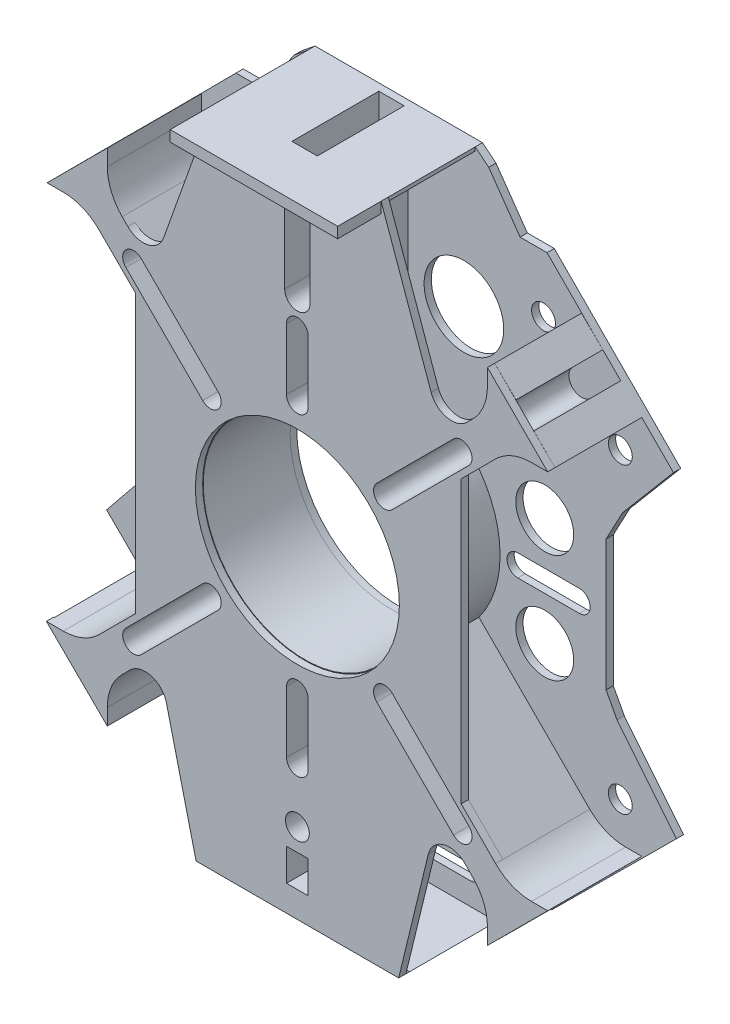
from build123d import *

# Parameters (mm, degrees)
BOSS_EXTRUDE1_OUTLINE_R         = 1.65
BOSS_EXTRUDE1_OUTLINE_R_2       = 9
BOSS_EXTRUDE1_DEPTH             = 1
SKETCH2_R                       = 14
SKETCH2_R_2                     = 1.65
SKETCH2_W                       = 3
SKETCH2_H                       = 4.43079702
BOSS_EXTRUDE2_DEPTH             = 12
BOSS_EXTRUDE2_DIRECTION_2_REACH = 63.396
SKETCH4_R                       = 14.089378666
SKETCH4_R_2                     = 1.65
SKETCH4_W                       = 3
SKETCH4_H                       = 4.43079702
BOSS_EXTRUDE3_DEPTH             = 1
SKETCH5_W                       = 23.128323924
SKETCH5_H                       = 1.5
BOSS_EXTRUDE4_DEPTH             = 6
CUT_EXTRUDE1_START              = -10
SKETCH6_R                       = 14.089378666
SKETCH6_R_2                     = 4
SKETCH6_R_3                     = 5.5
CUT_EXTRUDE1_DEPTH              = 10


# Read off the part's stored shape, not the designer's step: Boss-Extrude1
with BuildPart() as part:
    # Boss-Extrude1 outline → Boss-Extrude1 (new body)
    with BuildSketch(Plane.XY):
        Polygon((-13.989604918, -44.585312397), (13.989604918, -44.585312397), (15.364158174, -43.219581062), (15.364158174, -38.878084859), (22.144989251, -38.850540354), (39.351031245, -21.754927214), (31.155749084, -11.64882797), (29.63770528, -8.800437365), (29.63770528, 9.258229776), (31.914413679, 13.530145247), (38.947274579, 21.845237215), (21.483203913, 39.422116781), (17.759375685, 39.422116781), (13.431703833, 45.602672711), (11.564161962, 47.117107925), (-11.564161962, 47.117107925), (-13.431703833, 45.602672711), (-17.759375685, 39.422116781), (-21.483203913, 39.422116781), (-38.947274579, 21.845237215), (-31.914413679, 13.530145247), (-29.63770528, 9.258229776), (-29.63770528, -8.800437365), (-31.155749084, -11.64882797), (-39.351031245, -21.754927214), (-22.144989251, -38.850540354), (-15.364158174, -38.878084859), (-15.364158174, -43.219581062), align=None)
        with Locations((-21, -31.5)):
            Circle(BOSS_EXTRUDE1_OUTLINE_R, mode=Mode.SUBTRACT)
        with Locations((-31.606601718, -20.893398282)):
            Circle(BOSS_EXTRUDE1_OUTLINE_R, mode=Mode.SUBTRACT)
        with BuildLine():
            Line((-17.445654013, -1.5), (-25.945654013, -1.5))
            ThreePointArc((-25.945654013, -1.5), (-27.445654013, 0), (-25.945654013, 1.5))
            Line((-25.945654013, 1.5), (-17.445654013, 1.5))
            ThreePointArc((-17.445654013, 1.5), (-15.945654013, 0), (-17.445654013, -1.5))
        make_face(mode=Mode.SUBTRACT)
        with BuildLine():
            Line((-23.687647821, -21.566327477), (-13.081904801, -10.960584458))
            ThreePointArc((-13.081904801, -10.960584458), (-10.960584458, -10.960584458), (-10.960584458, -13.081904801))
            Line((-10.960584458, -13.081904801), (-21.566327477, -23.687647821))
            ThreePointArc((-21.566327477, -23.687647821), (-23.687647821, -23.687647821), (-23.687647821, -21.566327477))
        make_face(mode=Mode.SUBTRACT)
        with BuildLine():
            Line((11, -41), (-11, -41))
            ThreePointArc((-11, -41), (-12, -40), (-11, -39))
            Line((-11, -39), (11, -39))
            ThreePointArc((11, -39), (12, -40), (11, -41))
        make_face(mode=Mode.SUBTRACT)
        with Locations((0, -33.5)):
            Circle(BOSS_EXTRUDE1_OUTLINE_R, mode=Mode.SUBTRACT)
        with BuildLine():
            Line((1.5, -17.445654013), (1.5, -25.945654013))
            ThreePointArc((1.5, -25.945654013), (0, -27.445654013), (-1.5, -25.945654013))
            Line((-1.5, -25.945654013), (-1.5, -17.445654013))
            ThreePointArc((-1.5, -17.445654013), (0, -15.945654013), (1.5, -17.445654013))
        make_face(mode=Mode.SUBTRACT)
        with Locations((21, -31.5)):
            Circle(BOSS_EXTRUDE1_OUTLINE_R, mode=Mode.SUBTRACT)
        with BuildLine():
            Line((21.566327477, -23.687647821), (10.960584458, -13.081904801))
            ThreePointArc((10.960584458, -13.081904801), (10.960584458, -10.960584458), (13.081904801, -10.960584458))
            Line((13.081904801, -10.960584458), (23.687647821, -21.566327477))
            ThreePointArc((23.687647821, -21.566327477), (23.687647821, -23.687647821), (21.566327477, -23.687647821))
        make_face(mode=Mode.SUBTRACT)
        Circle(BOSS_EXTRUDE1_OUTLINE_R_2, mode=Mode.SUBTRACT)
        with Locations((31.606601718, -20.893398282)):
            Circle(BOSS_EXTRUDE1_OUTLINE_R, mode=Mode.SUBTRACT)
        with BuildLine():
            Line((17.445654013, 1.5), (25.945654013, 1.5))
            ThreePointArc((25.945654013, 1.5), (27.445654013, 0), (25.945654013, -1.5))
            Line((25.945654013, -1.5), (17.445654013, -1.5))
            ThreePointArc((17.445654013, -1.5), (15.945654013, 0), (17.445654013, 1.5))
        make_face(mode=Mode.SUBTRACT)
        with Locations((-31.606601718, 20.893398282)):
            Circle(BOSS_EXTRUDE1_OUTLINE_R, mode=Mode.SUBTRACT)
        with BuildLine():
            Line((-21.566327477, 23.687647821), (-10.960584458, 13.081904801))
            ThreePointArc((-10.960584458, 13.081904801), (-10.960584458, 10.960584458), (-13.081904801, 10.960584458))
            Line((-13.081904801, 10.960584458), (-23.687647821, 21.566327477))
            ThreePointArc((-23.687647821, 21.566327477), (-23.687647821, 23.687647821), (-21.566327477, 23.687647821))
        make_face(mode=Mode.SUBTRACT)
        with Locations((-21, 31.5)):
            Circle(BOSS_EXTRUDE1_OUTLINE_R, mode=Mode.SUBTRACT)
        with BuildLine():
            Line((-1.5, 17.445654013), (-1.5, 25.945654013))
            ThreePointArc((-1.5, 25.945654013), (0, 27.445654013), (1.5, 25.945654013))
            Line((1.5, 25.945654013), (1.5, 17.445654013))
            ThreePointArc((1.5, 17.445654013), (0, 15.945654013), (-1.5, 17.445654013))
        make_face(mode=Mode.SUBTRACT)
        with BuildLine():
            Line((23.687647821, 21.566327477), (13.081904801, 10.960584458))
            ThreePointArc((13.081904801, 10.960584458), (10.960584458, 10.960584458), (10.960584458, 13.081904801))
            Line((10.960584458, 13.081904801), (21.566327477, 23.687647821))
            ThreePointArc((21.566327477, 23.687647821), (23.687647821, 23.687647821), (23.687647821, 21.566327477))
        make_face(mode=Mode.SUBTRACT)
        with Locations((31.606601718, 20.893398282)):
            Circle(BOSS_EXTRUDE1_OUTLINE_R, mode=Mode.SUBTRACT)
        with BuildLine():
            Line((4.5, 41.855351652), (-4.5, 41.855351652))
            ThreePointArc((-4.5, 41.855351652), (-5.366043802, 42.721395454), (-4.5, 43.587439255))
            Line((-4.5, 43.587439255), (4.5, 43.587439255))
            ThreePointArc((4.5, 43.587439255), (5.366043802, 42.721395454), (4.5, 41.855351652))
        make_face(mode=Mode.SUBTRACT)
        with Locations((21, 31.5)):
            Circle(BOSS_EXTRUDE1_OUTLINE_R, mode=Mode.SUBTRACT)
    extrude(amount=BOSS_EXTRUDE1_DEPTH)

    # Sketch2 → Boss-Extrude2 (add)
    with BuildSketch(Plane.XY.offset(1)):
        with BuildLine():
            Line((-24.199747468, 27.381727984), (-8.895608333, 12.077588848))
            ThreePointArc((-8.895608333, 12.077588848), (-5.740251485, 13.858192988), (-2.25, 14.83028995))
            Line((-2.25, 14.83028995), (-2.25, 44.617107925))
            ThreePointArc((-2.25, 44.617107925), (-2.835786438, 46.031321488), (-4.25, 46.617107925))
            Line((-4.25, 46.617107925), (-11.564161962, 46.617107925))
            Line((-11.564161962, 46.617107925), (-11.564161962, 47.117107925))
            Line((-11.564161962, 47.117107925), (-1.75, 47.117107925))
            Line((-1.75, 47.117107925), (-1.75, 29.945654013))
            ThreePointArc((-1.75, 29.945654013), (0, 28.195654013), (1.75, 29.945654013))
            Line((1.75, 29.945654013), (1.75, 47.117107925))
            Line((1.75, 47.117107925), (11.564161962, 47.117107925))
            Line((11.564161962, 47.117107925), (11.564161962, 46.617107925))
            Line((11.564161962, 46.617107925), (4.25, 46.617107925))
            ThreePointArc((4.25, 46.617107925), (2.835786438, 46.031321488), (2.25, 44.617107925))
            Line((2.25, 44.617107925), (2.25, 14.83028995))
            ThreePointArc((2.25, 14.83028995), (5.740251485, 13.858192988), (8.895608333, 12.077588848))
            Line((8.895608333, 12.077588848), (24.199747468, 27.381727984))
            ThreePointArc((24.199747468, 27.381727984), (25.717156728, 29.652691425), (26.25, 32.331475452))
            Line((26.25, 32.331475452), (26.25, 34.570781684))
            Line((26.25, 34.570781684), (29.190331443, 31.665205177))
            Line((29.190331443, 31.665205177), (25.012563133, 27.487436867))
            ThreePointArc((25.012563133, 27.487436867), (25.012563133, 25.012563133), (27.487436867, 25.012563133))
            Line((27.487436867, 25.012563133), (31.657237705, 29.182363971))
            Line((31.657237705, 29.182363971), (34.570781684, 26.25))
            Line((34.570781684, 26.25), (32.331475452, 26.25))
            ThreePointArc((32.331475452, 26.25), (29.652691425, 25.717156728), (27.381727984, 24.199747468))
            Line((27.381727984, 24.199747468), (12.077588848, 8.895608333))
            ThreePointArc((12.077588848, 8.895608333), (15, 0), (12.077588848, -8.895608333))
            Line((12.077588848, -8.895608333), (27.381727984, -24.199747468))
            ThreePointArc((27.381727984, -24.199747468), (29.652691425, -25.717156728), (32.331475452, -26.25))
            Line((32.331475452, -26.25), (34.570781684, -26.25))
            Line((34.570781684, -26.25), (31.657237705, -29.182363971))
            Line((31.657237705, -29.182363971), (27.487436867, -25.012563133))
            ThreePointArc((27.487436867, -25.012563133), (25.012563133, -25.012563133), (25.012563133, -27.487436867))
            Line((25.012563133, -27.487436867), (29.190331443, -31.665205177))
            Line((29.190331443, -31.665205177), (26.25, -34.570781684))
            Line((26.25, -34.570781684), (26.25, -32.331475452))
            ThreePointArc((26.25, -32.331475452), (25.717156728, -29.652691425), (24.199747468, -27.381727984))
            Line((24.199747468, -27.381727984), (8.895608333, -12.077588848))
            ThreePointArc((8.895608333, -12.077588848), (5.740251485, -13.858192988), (2.25, -14.83028995))
            Line((2.25, -14.83028995), (2.25, -42.085312397))
            ThreePointArc((2.25, -42.085312397), (2.835786438, -43.49952596), (4.25, -44.085312397))
            Line((4.25, -44.085312397), (14.49283466, -44.085312397))
            Line((14.49283466, -44.085312397), (13.989604918, -44.585312397))
            Line((13.989604918, -44.585312397), (-13.989604918, -44.585312397))
            Line((-13.989604918, -44.585312397), (-14.49283466, -44.085312397))
            Line((-14.49283466, -44.085312397), (-4.25, -44.085312397))
            ThreePointArc((-4.25, -44.085312397), (-2.835786438, -43.49952596), (-2.25, -42.085312397))
            Line((-2.25, -42.085312397), (-2.25, -14.83028995))
            ThreePointArc((-2.25, -14.83028995), (-5.740251485, -13.858192988), (-8.895608333, -12.077588848))
            Line((-8.895608333, -12.077588848), (-24.199747468, -27.381727984))
            ThreePointArc((-24.199747468, -27.381727984), (-25.717156728, -29.652691425), (-26.25, -32.331475452))
            Line((-26.25, -32.331475452), (-26.25, -34.570781684))
            Line((-26.25, -34.570781684), (-29.190331443, -31.665205177))
            Line((-29.190331443, -31.665205177), (-25.012563133, -27.487436867))
            ThreePointArc((-25.012563133, -27.487436867), (-25.012563133, -25.012563133), (-27.487436867, -25.012563133))
            Line((-27.487436867, -25.012563133), (-31.657237705, -29.182363971))
            Line((-31.657237705, -29.182363971), (-34.570781684, -26.25))
            Line((-34.570781684, -26.25), (-32.331475452, -26.25))
            ThreePointArc((-32.331475452, -26.25), (-29.652691425, -25.717156728), (-27.381727984, -24.199747468))
            Line((-27.381727984, -24.199747468), (-12.077588848, -8.895608333))
            ThreePointArc((-12.077588848, -8.895608333), (-15, 0), (-12.077588848, 8.895608333))
            Line((-12.077588848, 8.895608333), (-27.381727984, 24.199747468))
            ThreePointArc((-27.381727984, 24.199747468), (-29.652691425, 25.717156728), (-32.331475452, 26.25))
            Line((-32.331475452, 26.25), (-34.570781684, 26.25))
            Line((-34.570781684, 26.25), (-31.657237705, 29.182363971))
            Line((-31.657237705, 29.182363971), (-27.487436867, 25.012563133))
            ThreePointArc((-27.487436867, 25.012563133), (-25.012563133, 25.012563133), (-25.012563133, 27.487436867))
            Line((-25.012563133, 27.487436867), (-29.190331443, 31.665205177))
            Line((-29.190331443, 31.665205177), (-26.25, 34.570781684))
            Line((-26.25, 34.570781684), (-26.25, 32.331475452))
            ThreePointArc((-26.25, 32.331475452), (-25.717156728, 29.652691425), (-24.199747468, 27.381727984))
        make_face()
        Circle(SKETCH2_R, mode=Mode.SUBTRACT)
        with Locations((0, -33.5)):
            Circle(SKETCH2_R_2, mode=Mode.SUBTRACT)
        with Locations((0, -38.78460149)):
            Rectangle(SKETCH2_W, SKETCH2_H, mode=Mode.SUBTRACT)
        with BuildLine():
            Line((21.566327477, 23.687647821), (10.960584458, 13.081904801))
            ThreePointArc((10.960584458, 13.081904801), (10.960584458, 10.960584458), (13.081904801, 10.960584458))
            Line((13.081904801, 10.960584458), (23.687647821, 21.566327477))
            ThreePointArc((23.687647821, 21.566327477), (23.687647821, 23.687647821), (21.566327477, 23.687647821))
        make_face(mode=Mode.SUBTRACT)
        with BuildLine():
            Line((-1.5, 17.445654013), (-1.5, 25.945654013))
            ThreePointArc((-1.5, 25.945654013), (0, 27.445654013), (1.5, 25.945654013))
            Line((1.5, 25.945654013), (1.5, 17.445654013))
            ThreePointArc((1.5, 17.445654013), (0, 15.945654013), (-1.5, 17.445654013))
        make_face(mode=Mode.SUBTRACT)
        with BuildLine():
            Line((-23.687647821, 21.566327477), (-13.081904801, 10.960584458))
            ThreePointArc((-13.081904801, 10.960584458), (-10.960584458, 10.960584458), (-10.960584458, 13.081904801))
            Line((-10.960584458, 13.081904801), (-21.566327477, 23.687647821))
            ThreePointArc((-21.566327477, 23.687647821), (-23.687647821, 23.687647821), (-23.687647821, 21.566327477))
        make_face(mode=Mode.SUBTRACT)
        with BuildLine():
            Line((21.566327477, -23.687647821), (10.960584458, -13.081904801))
            ThreePointArc((10.960584458, -13.081904801), (10.960584458, -10.960584458), (13.081904801, -10.960584458))
            Line((13.081904801, -10.960584458), (23.687647821, -21.566327477))
            ThreePointArc((23.687647821, -21.566327477), (23.687647821, -23.687647821), (21.566327477, -23.687647821))
        make_face(mode=Mode.SUBTRACT)
        with BuildLine():
            Line((1.5, -17.445654013), (1.5, -25.945654013))
            ThreePointArc((1.5, -25.945654013), (0, -27.445654013), (-1.5, -25.945654013))
            Line((-1.5, -25.945654013), (-1.5, -17.445654013))
            ThreePointArc((-1.5, -17.445654013), (0, -15.945654013), (1.5, -17.445654013))
        make_face(mode=Mode.SUBTRACT)
        with BuildLine():
            Line((-21.566327477, -23.687647821), (-10.960584458, -13.081904801))
            ThreePointArc((-10.960584458, -13.081904801), (-10.960584458, -10.960584458), (-13.081904801, -10.960584458))
            Line((-13.081904801, -10.960584458), (-23.687647821, -21.566327477))
            ThreePointArc((-23.687647821, -21.566327477), (-23.687647821, -23.687647821), (-21.566327477, -23.687647821))
        make_face(mode=Mode.SUBTRACT)
    extrude(amount=BOSS_EXTRUDE2_DEPTH)

    # Boss-Extrude2 direction 2: up to this face of the body (flat: up to its plane)
    boss_extrude2_direction_2_end = Plane(part.part.faces().sort_by_distance((0, -43.376869244, 0))[0])
    # Sketch2 → Boss-Extrude2 direction 2 (add, up to the picked face)
    with BuildSketch(Plane.XY.offset(1), mode=Mode.PRIVATE) as boss_extrude2_direction_2_sk1:
        with BuildLine():
            Line((-24.199747468, 27.381727984), (-8.895608333, 12.077588848))
            ThreePointArc((-8.895608333, 12.077588848), (-5.740251485, 13.858192988), (-2.25, 14.83028995))
            Line((-2.25, 14.83028995), (-2.25, 44.617107925))
            ThreePointArc((-2.25, 44.617107925), (-2.835786438, 46.031321488), (-4.25, 46.617107925))
            Line((-4.25, 46.617107925), (-11.564161962, 46.617107925))
            Line((-11.564161962, 46.617107925), (-11.564161962, 47.117107925))
            Line((-11.564161962, 47.117107925), (-1.75, 47.117107925))
            Line((-1.75, 47.117107925), (-1.75, 29.945654013))
            ThreePointArc((-1.75, 29.945654013), (0, 28.195654013), (1.75, 29.945654013))
            Line((1.75, 29.945654013), (1.75, 47.117107925))
            Line((1.75, 47.117107925), (11.564161962, 47.117107925))
            Line((11.564161962, 47.117107925), (11.564161962, 46.617107925))
            Line((11.564161962, 46.617107925), (4.25, 46.617107925))
            ThreePointArc((4.25, 46.617107925), (2.835786438, 46.031321488), (2.25, 44.617107925))
            Line((2.25, 44.617107925), (2.25, 14.83028995))
            ThreePointArc((2.25, 14.83028995), (5.740251485, 13.858192988), (8.895608333, 12.077588848))
            Line((8.895608333, 12.077588848), (24.199747468, 27.381727984))
            ThreePointArc((24.199747468, 27.381727984), (25.717156728, 29.652691425), (26.25, 32.331475452))
            Line((26.25, 32.331475452), (26.25, 34.570781684))
            Line((26.25, 34.570781684), (29.190331443, 31.665205177))
            Line((29.190331443, 31.665205177), (25.012563133, 27.487436867))
            ThreePointArc((25.012563133, 27.487436867), (25.012563133, 25.012563133), (27.487436867, 25.012563133))
            Line((27.487436867, 25.012563133), (31.657237705, 29.182363971))
            Line((31.657237705, 29.182363971), (34.570781684, 26.25))
            Line((34.570781684, 26.25), (32.331475452, 26.25))
            ThreePointArc((32.331475452, 26.25), (29.652691425, 25.717156728), (27.381727984, 24.199747468))
            Line((27.381727984, 24.199747468), (12.077588848, 8.895608333))
            ThreePointArc((12.077588848, 8.895608333), (15, 0), (12.077588848, -8.895608333))
            Line((12.077588848, -8.895608333), (27.381727984, -24.199747468))
            ThreePointArc((27.381727984, -24.199747468), (29.652691425, -25.717156728), (32.331475452, -26.25))
            Line((32.331475452, -26.25), (34.570781684, -26.25))
            Line((34.570781684, -26.25), (31.657237705, -29.182363971))
            Line((31.657237705, -29.182363971), (27.487436867, -25.012563133))
            ThreePointArc((27.487436867, -25.012563133), (25.012563133, -25.012563133), (25.012563133, -27.487436867))
            Line((25.012563133, -27.487436867), (29.190331443, -31.665205177))
            Line((29.190331443, -31.665205177), (26.25, -34.570781684))
            Line((26.25, -34.570781684), (26.25, -32.331475452))
            ThreePointArc((26.25, -32.331475452), (25.717156728, -29.652691425), (24.199747468, -27.381727984))
            Line((24.199747468, -27.381727984), (8.895608333, -12.077588848))
            ThreePointArc((8.895608333, -12.077588848), (5.740251485, -13.858192988), (2.25, -14.83028995))
            Line((2.25, -14.83028995), (2.25, -42.085312397))
            ThreePointArc((2.25, -42.085312397), (2.835786438, -43.49952596), (4.25, -44.085312397))
            Line((4.25, -44.085312397), (14.49283466, -44.085312397))
            Line((14.49283466, -44.085312397), (13.989604918, -44.585312397))
            Line((13.989604918, -44.585312397), (-13.989604918, -44.585312397))
            Line((-13.989604918, -44.585312397), (-14.49283466, -44.085312397))
            Line((-14.49283466, -44.085312397), (-4.25, -44.085312397))
            ThreePointArc((-4.25, -44.085312397), (-2.835786438, -43.49952596), (-2.25, -42.085312397))
            Line((-2.25, -42.085312397), (-2.25, -14.83028995))
            ThreePointArc((-2.25, -14.83028995), (-5.740251485, -13.858192988), (-8.895608333, -12.077588848))
            Line((-8.895608333, -12.077588848), (-24.199747468, -27.381727984))
            ThreePointArc((-24.199747468, -27.381727984), (-25.717156728, -29.652691425), (-26.25, -32.331475452))
            Line((-26.25, -32.331475452), (-26.25, -34.570781684))
            Line((-26.25, -34.570781684), (-29.190331443, -31.665205177))
            Line((-29.190331443, -31.665205177), (-25.012563133, -27.487436867))
            ThreePointArc((-25.012563133, -27.487436867), (-25.012563133, -25.012563133), (-27.487436867, -25.012563133))
            Line((-27.487436867, -25.012563133), (-31.657237705, -29.182363971))
            Line((-31.657237705, -29.182363971), (-34.570781684, -26.25))
            Line((-34.570781684, -26.25), (-32.331475452, -26.25))
            ThreePointArc((-32.331475452, -26.25), (-29.652691425, -25.717156728), (-27.381727984, -24.199747468))
            Line((-27.381727984, -24.199747468), (-12.077588848, -8.895608333))
            ThreePointArc((-12.077588848, -8.895608333), (-15, 0), (-12.077588848, 8.895608333))
            Line((-12.077588848, 8.895608333), (-27.381727984, 24.199747468))
            ThreePointArc((-27.381727984, 24.199747468), (-29.652691425, 25.717156728), (-32.331475452, 26.25))
            Line((-32.331475452, 26.25), (-34.570781684, 26.25))
            Line((-34.570781684, 26.25), (-31.657237705, 29.182363971))
            Line((-31.657237705, 29.182363971), (-27.487436867, 25.012563133))
            ThreePointArc((-27.487436867, 25.012563133), (-25.012563133, 25.012563133), (-25.012563133, 27.487436867))
            Line((-25.012563133, 27.487436867), (-29.190331443, 31.665205177))
            Line((-29.190331443, 31.665205177), (-26.25, 34.570781684))
            Line((-26.25, 34.570781684), (-26.25, 32.331475452))
            ThreePointArc((-26.25, 32.331475452), (-25.717156728, 29.652691425), (-24.199747468, 27.381727984))
        make_face()
        Circle(SKETCH2_R, mode=Mode.SUBTRACT)
        with Locations((0, -33.5)):
            Circle(SKETCH2_R_2, mode=Mode.SUBTRACT)
        with Locations((0, -38.78460149)):
            Rectangle(SKETCH2_W, SKETCH2_H, mode=Mode.SUBTRACT)
        with BuildLine():
            Line((21.566327477, 23.687647821), (10.960584458, 13.081904801))
            ThreePointArc((10.960584458, 13.081904801), (10.960584458, 10.960584458), (13.081904801, 10.960584458))
            Line((13.081904801, 10.960584458), (23.687647821, 21.566327477))
            ThreePointArc((23.687647821, 21.566327477), (23.687647821, 23.687647821), (21.566327477, 23.687647821))
        make_face(mode=Mode.SUBTRACT)
        with BuildLine():
            Line((-1.5, 17.445654013), (-1.5, 25.945654013))
            ThreePointArc((-1.5, 25.945654013), (0, 27.445654013), (1.5, 25.945654013))
            Line((1.5, 25.945654013), (1.5, 17.445654013))
            ThreePointArc((1.5, 17.445654013), (0, 15.945654013), (-1.5, 17.445654013))
        make_face(mode=Mode.SUBTRACT)
        with BuildLine():
            Line((-23.687647821, 21.566327477), (-13.081904801, 10.960584458))
            ThreePointArc((-13.081904801, 10.960584458), (-10.960584458, 10.960584458), (-10.960584458, 13.081904801))
            Line((-10.960584458, 13.081904801), (-21.566327477, 23.687647821))
            ThreePointArc((-21.566327477, 23.687647821), (-23.687647821, 23.687647821), (-23.687647821, 21.566327477))
        make_face(mode=Mode.SUBTRACT)
        with BuildLine():
            Line((21.566327477, -23.687647821), (10.960584458, -13.081904801))
            ThreePointArc((10.960584458, -13.081904801), (10.960584458, -10.960584458), (13.081904801, -10.960584458))
            Line((13.081904801, -10.960584458), (23.687647821, -21.566327477))
            ThreePointArc((23.687647821, -21.566327477), (23.687647821, -23.687647821), (21.566327477, -23.687647821))
        make_face(mode=Mode.SUBTRACT)
        with BuildLine():
            Line((1.5, -17.445654013), (1.5, -25.945654013))
            ThreePointArc((1.5, -25.945654013), (0, -27.445654013), (-1.5, -25.945654013))
            Line((-1.5, -25.945654013), (-1.5, -17.445654013))
            ThreePointArc((-1.5, -17.445654013), (0, -15.945654013), (1.5, -17.445654013))
        make_face(mode=Mode.SUBTRACT)
        with BuildLine():
            Line((-21.566327477, -23.687647821), (-10.960584458, -13.081904801))
            ThreePointArc((-10.960584458, -13.081904801), (-10.960584458, -10.960584458), (-13.081904801, -10.960584458))
            Line((-13.081904801, -10.960584458), (-23.687647821, -21.566327477))
            ThreePointArc((-23.687647821, -21.566327477), (-23.687647821, -23.687647821), (-21.566327477, -23.687647821))
        make_face(mode=Mode.SUBTRACT)
    boss_extrude2_direction_2_tool1 = split(extrude(boss_extrude2_direction_2_sk1.sketch, amount=-BOSS_EXTRUDE2_DIRECTION_2_REACH, mode=Mode.PRIVATE), bisect_by=boss_extrude2_direction_2_end, keep=Keep.BOTH, mode=Mode.PRIVATE)
    add(boss_extrude2_direction_2_tool1.solids().sort_by(Axis((-19.648449, -16.628887, 1), (0, 0, -1)))[0])

    # Sketch4 → Boss-Extrude3 (add)
    with BuildSketch(Plane.XY.offset(13)):
        with BuildLine():
            Line((-18.471725004, 27.716296262), (-11.564161962, 47.117107925))
            Line((-11.564161962, 47.117107925), (11.564161962, 47.117107925))
            Line((11.564161962, 47.117107925), (18.471725004, 27.716296262))
            ThreePointArc((18.471725004, 27.716296262), (20.638342961, 25.795961092), (23.419252472, 26.601232987))
            Line((23.419252472, 26.601232987), (24.199747468, 27.381727984))
            ThreePointArc((24.199747468, 27.381727984), (25.717156728, 29.652691425), (26.25, 32.331475452))
            Line((26.25, 32.331475452), (26.25, 34.570781684))
            Line((26.25, 34.570781684), (34.570781684, 26.25))
            Line((34.570781684, 26.25), (32.331475452, 26.25))
            ThreePointArc((32.331475452, 26.25), (29.652691425, 25.717156728), (27.381727984, 24.199747468))
            Line((27.381727984, 24.199747468), (22.626987649, 19.445007134))
            Line((22.626987649, 19.445007134), (22.626987649, -19.436431298))
            Line((22.626987649, -19.436431298), (27.381727984, -24.199747468))
            ThreePointArc((27.381727984, -24.199747468), (29.652691425, -25.717156728), (32.331475452, -26.25))
            Line((32.331475452, -26.25), (34.570781684, -26.25))
            Line((34.570781684, -26.25), (26.25, -34.570781684))
            Line((26.25, -34.570781684), (26.25, -32.331475452))
            ThreePointArc((26.25, -32.331475452), (25.717156728, -29.652691425), (24.199747468, -27.381727984))
            Line((24.199747468, -27.381727984), (23.123477043, -26.305457558))
            ThreePointArc((23.123477043, -26.305457558), (20.191717874, -25.538320025), (18.086940552, -27.718600796))
            Line((18.086940552, -27.718600796), (13.989604918, -44.585312397))
            Line((13.989604918, -44.585312397), (-13.989604918, -44.585312397))
            Line((-13.989604918, -44.585312397), (-18.086940552, -27.718600796))
            ThreePointArc((-18.086940552, -27.718600796), (-20.191717874, -25.538320025), (-23.123477043, -26.305457558))
            Line((-23.123477043, -26.305457558), (-24.199747468, -27.381727984))
            ThreePointArc((-24.199747468, -27.381727984), (-25.717156728, -29.652691425), (-26.25, -32.331475452))
            Line((-26.25, -32.331475452), (-26.25, -34.570781684))
            Line((-26.25, -34.570781684), (-34.67031038, -26.25))
            Line((-34.67031038, -26.25), (-32.331475452, -26.25))
            ThreePointArc((-32.331475452, -26.25), (-29.652691425, -25.717156728), (-27.381727984, -24.199747468))
            Line((-27.381727984, -24.199747468), (-22.373012351, -19.191031836))
            Line((-22.373012351, -19.191031836), (-22.373012351, 19.191031836))
            Line((-22.373012351, 19.191031836), (-27.381727984, 24.199747468))
            ThreePointArc((-27.381727984, 24.199747468), (-29.652691425, 25.717156728), (-32.331475452, 26.25))
            Line((-32.331475452, 26.25), (-34.570781684, 26.25))
            Line((-34.570781684, 26.25), (-26.25, 34.570781684))
            Line((-26.25, 34.570781684), (-26.25, 32.331475452))
            ThreePointArc((-26.25, 32.331475452), (-25.717156728, 29.652691425), (-24.199747468, 27.381727984))
            Line((-24.199747468, 27.381727984), (-23.419252472, 26.601232987))
            ThreePointArc((-23.419252472, 26.601232987), (-20.638342961, 25.795961092), (-18.471725004, 27.716296262))
        make_face()
        Circle(SKETCH4_R, mode=Mode.SUBTRACT)
        with Locations((0, -33.5)):
            Circle(SKETCH4_R_2, mode=Mode.SUBTRACT)
        with Locations((0, -38.78460149)):
            Rectangle(SKETCH4_W, SKETCH4_H, mode=Mode.SUBTRACT)
        with BuildLine():
            Line((10.960584458, -13.081904801), (21.566327477, -23.687647821))
            ThreePointArc((21.566327477, -23.687647821), (23.687647821, -23.687647821), (23.687647821, -21.566327477))
            Line((23.687647821, -21.566327477), (13.081904801, -10.960584458))
            ThreePointArc((13.081904801, -10.960584458), (10.960584458, -10.960584458), (10.960584458, -13.081904801))
        make_face(mode=Mode.SUBTRACT)
        with BuildLine():
            Line((-23.687647821, 21.566327477), (-13.081904801, 10.960584458))
            ThreePointArc((-13.081904801, 10.960584458), (-10.960584458, 10.960584458), (-10.960584458, 13.081904801))
            Line((-10.960584458, 13.081904801), (-21.566327477, 23.687647821))
            ThreePointArc((-21.566327477, 23.687647821), (-23.687647821, 23.687647821), (-23.687647821, 21.566327477))
        make_face(mode=Mode.SUBTRACT)
        with BuildLine():
            Line((-21.566327477, -23.687647821), (-10.960584458, -13.081904801))
            ThreePointArc((-10.960584458, -13.081904801), (-10.960584458, -10.960584458), (-13.081904801, -10.960584458))
            Line((-13.081904801, -10.960584458), (-23.687647821, -21.566327477))
            ThreePointArc((-23.687647821, -21.566327477), (-23.687647821, -23.687647821), (-21.566327477, -23.687647821))
        make_face(mode=Mode.SUBTRACT)
        with BuildLine():
            Line((1.5, -25.945654013), (1.5, -17.445654013))
            ThreePointArc((1.5, -17.445654013), (0, -15.945654013), (-1.5, -17.445654013))
            Line((-1.5, -17.445654013), (-1.5, -25.945654013))
            ThreePointArc((-1.5, -25.945654013), (0, -27.445654013), (1.5, -25.945654013))
        make_face(mode=Mode.SUBTRACT)
        with BuildLine():
            Line((-1.75, 29.945654013), (-1.75, 43.945654013))
            Line((-1.75, 43.945654013), (1.75, 43.945654013))
            Line((1.75, 43.945654013), (1.75, 29.945654013))
            ThreePointArc((1.75, 29.945654013), (0, 28.195654013), (-1.75, 29.945654013))
        make_face(mode=Mode.SUBTRACT)
        with BuildLine():
            Line((1.5, 17.445654013), (1.5, 25.945654013))
            ThreePointArc((1.5, 25.945654013), (0, 27.445654013), (-1.5, 25.945654013))
            Line((-1.5, 25.945654013), (-1.5, 17.445654013))
            ThreePointArc((-1.5, 17.445654013), (0, 15.945654013), (1.5, 17.445654013))
        make_face(mode=Mode.SUBTRACT)
        with BuildLine():
            Line((23.687647821, 21.566327477), (13.081904801, 10.960584458))
            ThreePointArc((13.081904801, 10.960584458), (10.960584458, 10.960584458), (10.960584458, 13.081904801))
            Line((10.960584458, 13.081904801), (21.566327477, 23.687647821))
            ThreePointArc((21.566327477, 23.687647821), (23.687647821, 23.687647821), (23.687647821, 21.566327477))
        make_face(mode=Mode.SUBTRACT)
    extrude(amount=BOSS_EXTRUDE3_DEPTH)

    # Sketch5 → Boss-Extrude4 (add)
    with BuildSketch(Plane.XY.offset(14)):
        with Locations((0, 46.367107925)):
            Rectangle(SKETCH5_W, SKETCH5_H)
    extrude(amount=BOSS_EXTRUDE4_DEPTH)

    # Sketch6 → Cut-Extrude1 (cut)
    with BuildSketch(Plane.XY.offset(1).offset(CUT_EXTRUDE1_START)):
        Circle(SKETCH6_R)
        with Locations((21.166261755, 7.5)):
            Circle(SKETCH6_R_2)
        with Locations((21.166261755, -7.5)):
            Circle(SKETCH6_R_2)
        with Locations((-21.166261755, -7.5)):
            Circle(SKETCH6_R_2)
        with Locations((-21.166261755, 7.5)):
            Circle(SKETCH6_R_2)
        with Locations((-10, 27.248473947)):
            Circle(SKETCH6_R_3)
        with Locations((10, 27.248473947)):
            Circle(SKETCH6_R_3)
        with Locations((-10, -27.248473947)):
            Circle(SKETCH6_R_3)
        with Locations((10, -27.248473947)):
            Circle(SKETCH6_R_3)
    extrude(amount=CUT_EXTRUDE1_DEPTH, mode=Mode.SUBTRACT)


solid = part.part
